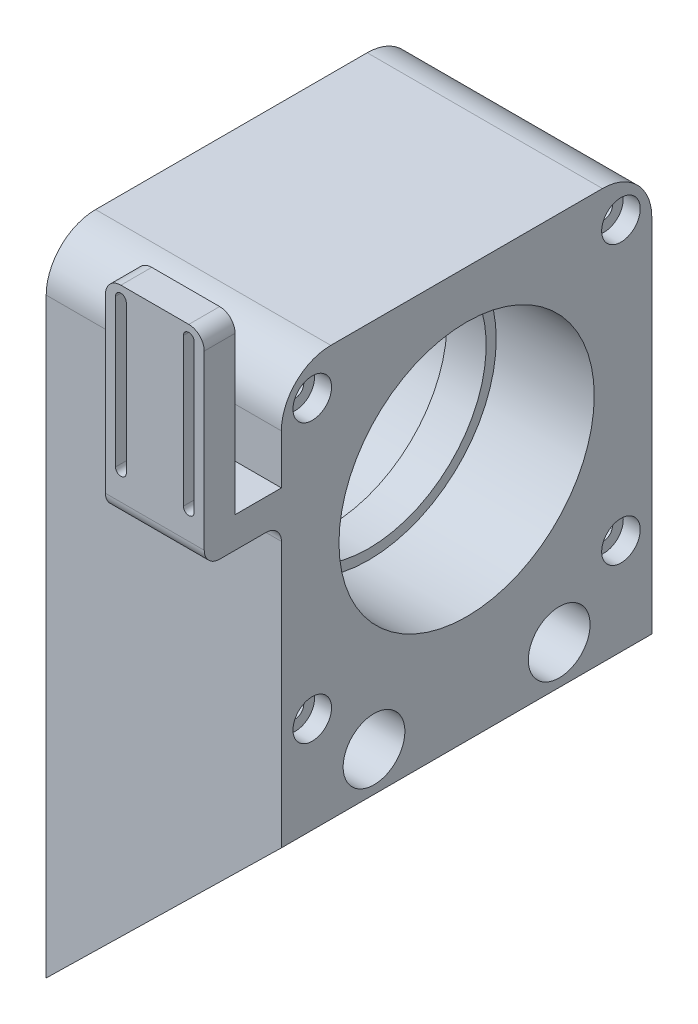
from build123d import *

# Parameters (mm, degrees)
BOSS_EXTRUDE1_DEPTH = 120
SKETCH3_R           = 4.25
CUT_EXTRUDE1_DEPTH  = 120
SKETCH5_R           = 10
CUT_EXTRUDE2_DEPTH  = 53
SKETCH6_R           = 4.25
CUT_EXTRUDE3_DEPTH  = 103
SKETCH7_W           = 76.2
SKETCH7_H           = 120
BOSS_EXTRUDE2_DEPTH = 101.6
SKETCH8_R           = 41.35
CUT_EXTRUDE4_DEPTH  = 31.75
CUT_EXTRUDE5_START  = -31.75
SKETCH9_R           = 41.35
CUT_EXTRUDE5_DEPTH  = 31.75
SKETCH10_R          = 38.1
CUT_EXTRUDE6_DEPTH  = 76.2
SKETCH13_W          = 76.2
SKETCH13_H          = 120
BOSS_EXTRUDE3_DEPTH = 6
SKETCH11_R          = 2.75
CUT_EXTRUDE7_DEPTH  = 84.4
SKETCH12_R          = 6.25
CUT_EXTRUDE8_DEPTH  = 5.5
FILLET1_R           = 16
SKETCH18_W          = 32
SKETCH18_H          = 10
BOSS_EXTRUDE6_DEPTH = 15
SKETCH20_W          = 32
SKETCH20_H          = 65.882542047
BOSS_EXTRUDE7_DEPTH = 10
FILLET3_R           = 5


with BuildPart() as part:
    # Sketch1 → Boss-Extrude1 (new body)
    with BuildSketch(Plane.XY):
        Polygon((381, 457.2), (457.2, 457.2), (457.2, 431.8), (381, 357.2), align=None)
    extrude(amount=BOSS_EXTRUDE1_DEPTH)

    # Sketch3 → Cut-Extrude1 (cut)
    with BuildSketch(Plane(origin=(457.2, 0, 0), x_dir=(0, 0, -1), z_dir=(1, 0, 0))):
        with Locations((-90, 394.5)):
            Circle(SKETCH3_R)
        with Locations((-30, 394.5)):
            Circle(SKETCH3_R)
    extrude(amount=-CUT_EXTRUDE1_DEPTH, mode=Mode.SUBTRACT)

    # Sketch5 → Cut-Extrude2 (cut)
    with BuildSketch(Plane(origin=(457.2, 0, 0), x_dir=(0, 0, -1), z_dir=(1, 0, 0))):
        with Locations((-90, 394.5)):
            Circle(SKETCH5_R)
        with Locations((-30, 394.5)):
            Circle(SKETCH5_R)
        with Locations((-90, 444.5)):
            Circle(SKETCH5_R)
        with Locations((-30, 444.5)):
            Circle(SKETCH5_R)
    extrude(amount=-CUT_EXTRUDE2_DEPTH, mode=Mode.SUBTRACT)

    # Sketch6 → Cut-Extrude3 (cut)
    with BuildSketch(Plane(origin=(457.2, 0, 0), x_dir=(0, 0, -1), z_dir=(1, 0, 0))):
        with Locations((-90, 444.5)):
            Circle(SKETCH6_R)
        with Locations((-30, 444.5)):
            Circle(SKETCH6_R)
    extrude(amount=-CUT_EXTRUDE3_DEPTH, mode=Mode.SUBTRACT)

    # Sketch7 → Boss-Extrude2 (add)
    with BuildSketch(Plane(origin=(0, 457.2, 0), x_dir=(1, 0, 0), z_dir=(0, 1, 0))):
        with Locations((419.1, -60)):
            Rectangle(SKETCH7_W, SKETCH7_H)
    extrude(amount=BOSS_EXTRUDE2_DEPTH)

    # Sketch8 → Cut-Extrude4 (cut)
    with BuildSketch(Plane.ZY.offset(-381)):
        with Locations((60, 508)):
            Circle(SKETCH8_R)
    extrude(amount=-CUT_EXTRUDE4_DEPTH, mode=Mode.SUBTRACT)

    # Sketch9 → Cut-Extrude5 (cut)
    with BuildSketch(Plane(origin=(457.2, 0, 0), x_dir=(0, 0, -1), z_dir=(1, 0, 0)).offset(CUT_EXTRUDE5_START)):
        with Locations((-60, 508)):
            Circle(SKETCH9_R)
    extrude(amount=CUT_EXTRUDE5_DEPTH, mode=Mode.SUBTRACT)

    # Sketch10 → Cut-Extrude6 (cut)
    with BuildSketch(Plane(origin=(457.2, 0, 0), x_dir=(0, 0, -1), z_dir=(1, 0, 0))):
        with Locations((-60, 508)):
            Circle(SKETCH10_R)
    extrude(amount=-CUT_EXTRUDE6_DEPTH, mode=Mode.SUBTRACT)

    # Sketch13 → Boss-Extrude3 (add)
    with BuildSketch(Plane(origin=(0, 558.8, 0), x_dir=(1, 0, 0), z_dir=(0, 1, 0))):
        with Locations((419.1, -60)):
            Rectangle(SKETCH13_W, SKETCH13_H)
    extrude(amount=BOSS_EXTRUDE3_DEPTH)

    # Sketch11 → Cut-Extrude7 (cut)
    with BuildSketch(Plane(origin=(457.2, 0, 0), x_dir=(0, 0, -1), z_dir=(1, 0, 0))):
        with Locations((-110, 553)):
            Circle(SKETCH11_R)
        with Locations((-10, 553)):
            Circle(SKETCH11_R)
        with Locations((-110, 463)):
            Circle(SKETCH11_R)
        with Locations((-10, 463)):
            Circle(SKETCH11_R)
    extrude(amount=-CUT_EXTRUDE7_DEPTH, mode=Mode.SUBTRACT)

    # Sketch12 → Cut-Extrude8 (cut)
    with BuildSketch(Plane(origin=(457.2, 0, 0), x_dir=(0, 0, -1), z_dir=(1, 0, 0))):
        with Locations((-110, 553)):
            Circle(SKETCH12_R)
        with Locations((-10, 553)):
            Circle(SKETCH12_R)
        with Locations((-10, 463)):
            Circle(SKETCH12_R)
        with Locations((-110, 463)):
            Circle(SKETCH12_R)
    extrude(amount=-CUT_EXTRUDE8_DEPTH, mode=Mode.SUBTRACT)

    # Fillet1
    fillet1_edges = [part.edges().sort_by_distance(p)[0] for p in [
        (419.1, 564.8, 0),
        (419.1, 564.8, 120),
    ]]
    fillet(fillet1_edges, radius=FILLET1_R)

    # Sketch18 → Boss-Extrude6 (add)
    with BuildSketch(Plane.XY.offset(120)):
        with Locations((441.2, 527.8)):
            Rectangle(SKETCH18_W, SKETCH18_H)
    extrude(amount=BOSS_EXTRUDE6_DEPTH)

    # Sketch20 → Boss-Extrude7 (add)
    with BuildSketch(Plane.XY.offset(135)):
        with Locations((441.2, 555.741271024)):
            Rectangle(SKETCH20_W, SKETCH20_H)
        with BuildLine():
            ThreePointArc((450.45, 584.682542047), (452.2, 586.432542047), (453.95, 584.682542047))
            Line((453.95, 584.682542047), (453.95, 536.8))
            ThreePointArc((453.95, 536.8), (452.2, 535.05), (450.45, 536.8))
            Line((450.45, 536.8), (450.45, 584.682542047))
        make_face(mode=Mode.SUBTRACT)
        with BuildLine():
            ThreePointArc((428.45, 584.682542047), (430.2, 586.432542047), (431.95, 584.682542047))
            Line((431.95, 584.682542047), (431.95, 536.8))
            ThreePointArc((431.95, 536.8), (430.2, 535.05), (428.45, 536.8))
            Line((428.45, 536.8), (428.45, 584.682542047))
        make_face(mode=Mode.SUBTRACT)
    extrude(amount=BOSS_EXTRUDE7_DEPTH)

    # Fillet3
    fillet3_edges = [part.edges().sort_by_distance(p)[0] for p in [
        (441.2, 522.8, 145),
        (425.2, 588.682542047, 140),
        (457.2, 588.682542047, 140),
        (441.2, 522.8, 120),
    ]]
    fillet(fillet3_edges, radius=FILLET3_R)


solid = part.part
